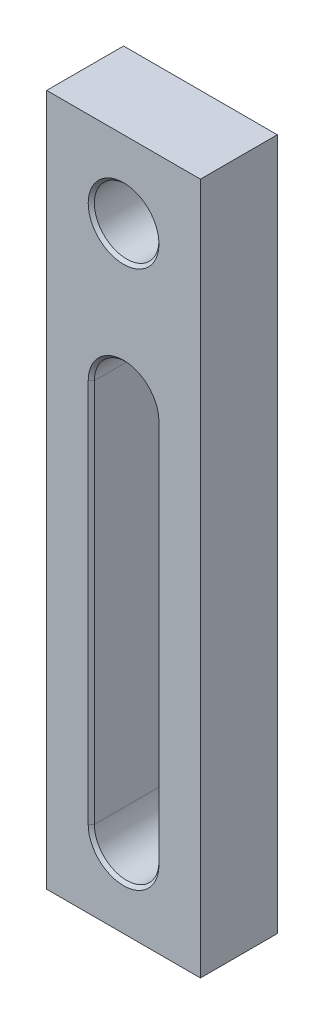
from build123d import *

# Parameters (mm, degrees)
SKETCH_1_W          = 50
SKETCH_1_H          = 225
EXTRUDE_1_DEPTH     = 25
SKETCH_2_R          = 10.5
CUT_EXTRUDE_1_DEPTH = 232.840462387
CHAMFER_1_SIZE      = 1


with BuildPart() as part:
    # Эскиз1 → Бобышка-Вытянуть1 (new body)
    with BuildSketch(Plane.XY):
        with Locations((25, 112.5)):
            Rectangle(SKETCH_1_W, SKETCH_1_H)
    extrude(amount=EXTRUDE_1_DEPTH)

    # Эскиз2 → Вырез-Вытянуть1 (cut, through all)
    with BuildSketch(Plane.XY.offset(25)):
        with Locations((25, 200)):
            Circle(SKETCH_2_R)
        with BuildLine():
            Line((14.5, 25), (14.5, 150))
            ThreePointArc((14.5, 150), (25, 160.5), (35.5, 150))
            Line((35.5, 150), (35.5, 25))
            ThreePointArc((35.5, 25), (25, 14.5), (14.5, 25))
        make_face()
    extrude(amount=-CUT_EXTRUDE_1_DEPTH, mode=Mode.SUBTRACT)

    # Фаска1
    chamfer_1_edges = [part.edges().sort_by_distance(p)[0] for p in [
        (14.5, 87.5, 0),
        (25, 14.5, 0),
        (25, 160.5, 0),
        (35.5, 87.5, 0),
        (35.5, 87.5, 25),
        (25, 160.5, 25),
        (25, 14.5, 25),
        (14.5, 87.5, 25),
        (14.5, 200, 0),
        (14.5, 200, 25),
    ]]
    chamfer(chamfer_1_edges, length=CHAMFER_1_SIZE)


solid = part.part
